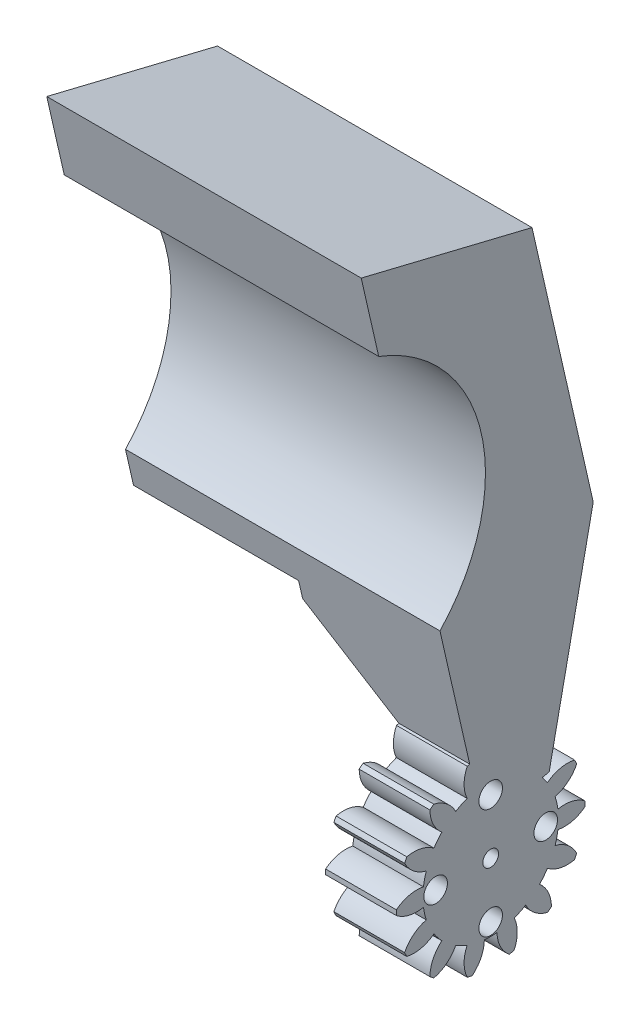
from build123d import *

# Parameters (mm, degrees)
BOSS_EXTRUDE1_START     = -9
BOSS_EXTRUDE1_OUTLINE_R = 1
BOSS_EXTRUDE1_DEPTH     = 9
BOSS_EXTRUDE1_START_2   = -10
BOSS_EXTRUDE1_2_DEPTH   = 1
BOSS_EXTRUDE2_START     = -40
BOSS_EXTRUDE2_DEPTH     = 40
CUT_EXTRUDE6_DEPTH      = 31
BOSS_EXTRUDE5_DEPTH     = 10
CHAMFER5_SIZE           = 10
SKETCH17_R              = 1.5000000000000002
SKETCH17_R_2            = 1.5000000000000004
SKETCH17_R_3            = 1.5
CUT_EXTRUDE7_DEPTH      = 81.58306320285853


with BuildPart() as part:
    # Boss-Extrude1: read off the stored shape, not the designer's step
    # Boss-Extrude1 outline → Boss-Extrude1 (new body)
    with BuildSketch(Plane(origin=(4.6139639648499715, 0, 0), x_dir=(0, 0, -1), z_dir=(1, 0, 0)).offset(BOSS_EXTRUDE1_START)):
        with BuildLine():
            ThreePointArc((-10.591117285, -4.446613705), (-10.456680456, -4.73552608), (-10.314619658, -5.020766944))
            ThreePointArc((-10.314619658, -5.020766944), (-8.502494616, -5.018593908), (-6.859954563, -4.253176333))
            ThreePointArc((-6.859954563, -4.253176333), (-6.387568746, -4.905897262), (-5.856328627, -5.51168345))
            ThreePointArc((-5.856328627, -5.51168345), (-6.968055133, -6.942720161), (-7.373409443, -8.708927899))
            ThreePointArc((-7.373409443, -8.708927899), (-7.126931664, -8.910899), (-6.875177934, -9.106254268))
            ThreePointArc((-6.875177934, -9.106254268), (-5.243452532, -8.318044841), (-4.095677319, -6.915756016))
            ThreePointArc((-4.095677319, -6.915756016), (-3.386867407, -7.298876727), (-2.645395822, -7.614174775))
            ThreePointArc((-2.645395822, -7.614174775), (-3.026123234, -9.385854353), (-2.625006031, -11.153029182))
            ThreePointArc((-2.625006031, -11.153029182), (-2.315305249, -11.228056157), (-2.003721502, -11.294833322))
            ThreePointArc((-2.003721502, -11.294833322), (-0.875578967, -9.876702048), (-0.449899552, -8.115282471))
            ThreePointArc((-0.449899552, -8.115282471), (0.354945958, -8.15292121), (1.159791469, -8.115282471))
            ThreePointArc((1.159791469, -8.115282471), (1.585470883, -9.876702048), (2.713613419, -11.294833322))
            ThreePointArc((2.713613419, -11.294833322), (3.025197166, -11.228056157), (3.334897948, -11.153029182))
            ThreePointArc((3.334897948, -11.153029182), (3.736015151, -9.385854353), (3.355287739, -7.614174775))
            ThreePointArc((3.355287739, -7.614174775), (4.096759324, -7.298876727), (4.805569236, -6.915756016))
            ThreePointArc((4.805569236, -6.915756016), (5.953344449, -8.318044841), (7.585069851, -9.106254268))
            ThreePointArc((7.585069851, -9.106254268), (7.836823581, -8.910899), (8.083301359, -8.708927899))
            ThreePointArc((8.083301359, -8.708927899), (7.677947049, -6.942720161), (6.566220544, -5.51168345))
            ThreePointArc((6.566220544, -5.51168345), (7.097460663, -4.905897262), (7.56984648, -4.253176333))
            ThreePointArc((7.56984648, -4.253176333), (9.212386533, -5.018593908), (11.024511575, -5.020766944))
            ThreePointArc((11.024511575, -5.020766944), (11.166572373, -4.73552608), (11.301009202, -4.446613705))
            ThreePointArc((11.301009202, -4.446613705), (10.169468771, -3.031192163), (8.546934241, -2.224232691))
            ThreePointArc((8.546934241, -2.224232691), (8.762724273, -1.447941745), (8.90512419, -0.654899984))
            ThreePointArc((8.90512419, -0.654899984), (10.717103882, -0.631845971), (12.350714974, 0.152447781))
            ThreePointArc((12.350714974, 0.152447781), (12.354945958, 0.47107879), (12.350714974, 0.789709799))
            ThreePointArc((12.350714974, 0.789709799), (10.717103881, 1.57400355), (8.90512419, 1.597057563))
            ThreePointArc((8.90512419, 1.597057563), (8.762724273, 2.390099324), (8.546934241, 3.16639027))
            ThreePointArc((8.546934241, 3.16639027), (10.169468771, 3.973349742), (11.301009202, 5.388771284))
            ThreePointArc((11.301009202, 5.388771284), (11.166572373, 5.677683659), (11.024511575, 5.962924523))
            ThreePointArc((11.024511575, 5.962924523), (9.212386533, 5.960751487), (7.56984648, 5.195333912))
            ThreePointArc((7.56984648, 5.195333912), (7.255600261, 5.643539152), (6.913552392, 6.070905362))
            Line((6.913552392, 6.070905362), (7.795891782, 6.27229357))
            Line((7.795891782, 6.27229357), (13.400397117, 33.194406922))
            Line((13.400397117, 33.194406922), (5.612164429, 67.316883848))
            Line((5.612164429, 67.316883848), (-16.111603154, 72.615744291))
            Line((-16.111603154, 72.615744291), (-13.886393815, 62.866465169))
            ThreePointArc((-13.886393815, 62.866465169), (-0.835936603, 47.895101758), (-6.098161126, 28.743988243))
            Line((-6.098161126, 28.743988243), (-2.315305249, 12.170213736))
            ThreePointArc((-2.315305249, 12.170213736), (-2.470404693, 12.133728304), (-2.625006031, 12.095186762))
            ThreePointArc((-2.625006031, 12.095186762), (-3.026123234, 10.328011932), (-2.645395822, 8.556332354))
            ThreePointArc((-2.645395822, 8.556332354), (-3.386867407, 8.241034306), (-4.095677319, 7.857913595))
            ThreePointArc((-4.095677319, 7.857913595), (-5.243452532, 9.260202421), (-6.875177934, 10.048411847))
            ThreePointArc((-6.875177934, 10.048411847), (-7.126931664, 9.853056579), (-7.373409443, 9.651085478))
            ThreePointArc((-7.373409443, 9.651085478), (-6.968055133, 7.88487774), (-5.856328627, 6.45384103))
            ThreePointArc((-5.856328627, 6.45384103), (-6.387568746, 5.848054841), (-6.859954563, 5.195333912))
            ThreePointArc((-6.859954563, 5.195333912), (-8.502494616, 5.960751487), (-10.314619658, 5.962924523))
            ThreePointArc((-10.314619658, 5.962924523), (-10.456680456, 5.677683659), (-10.591117285, 5.388771284))
            ThreePointArc((-10.591117285, 5.388771284), (-9.459576854, 3.973349742), (-7.837042324, 3.16639027))
            ThreePointArc((-7.837042324, 3.16639027), (-8.052832356, 2.390099324), (-8.195232274, 1.597057563))
            ThreePointArc((-8.195232274, 1.597057563), (-10.007211965, 1.57400355), (-11.640823057, 0.789709799))
            ThreePointArc((-11.640823057, 0.789709799), (-11.645054042, 0.47107879), (-11.640823057, 0.152447781))
            ThreePointArc((-11.640823057, 0.152447781), (-10.007211965, -0.631845971), (-8.195232274, -0.654899984))
            ThreePointArc((-8.195232274, -0.654899984), (-8.052832356, -1.447941745), (-7.837042324, -2.224232691))
            ThreePointArc((-7.837042324, -2.224232691), (-9.459576854, -3.031192163), (-10.591117285, -4.446613705))
        make_face()
        with Locations((0.354945958, 0.47107879)):
            Circle(BOSS_EXTRUDE1_OUTLINE_R, mode=Mode.SUBTRACT)
    extrude(amount=BOSS_EXTRUDE1_DEPTH)

    # Boss-Extrude1 2 outline → Boss-Extrude1 2 (add)
    with BuildSketch(Plane(origin=(4.6139639648499715, 0, 0), x_dir=(0, 0, -1), z_dir=(1, 0, 0)).offset(BOSS_EXTRUDE1_START_2)):
        with BuildLine():
            Line((-6.098161126, 28.743988243), (-0.535137777, 4.370790438))
            Line((-0.535137777, 4.370790438), (7.795891782, 6.27229357))
            Line((7.795891782, 6.27229357), (13.400397117, 33.194406922))
            Line((13.400397117, 33.194406922), (5.612164429, 67.316883848))
            Line((5.612164429, 67.316883848), (-16.111603154, 72.615744291))
            Line((-16.111603154, 72.615744291), (-13.886393815, 62.866465169))
            ThreePointArc((-13.886393815, 62.866465169), (-0.835936603, 47.895101758), (-6.098161126, 28.743988243))
        make_face()
    extrude(amount=BOSS_EXTRUDE1_2_DEPTH)

    # Sketch2 → Boss-Extrude2 (add)
    with BuildSketch(Plane(origin=(4.6139639648499715, 0, 0), x_dir=(0, 0, -1), z_dir=(1, 0, 0)).offset(BOSS_EXTRUDE2_START)):
        with BuildLine():
            Line((-16.11160315441779, 72.61574429110016), (5.612164428781802, 67.31688384840837))
            Line((5.612164428781802, 67.31688384840837), (13.400397117252913, 33.19440692204444))
            Line((13.400397117252913, 33.19440692204444), (8.3052597658331, 8.719121931463299))
            Line((8.3052597658331, 8.719121931463299), (-1.647742447257206, 9.245429999281619))
            Line((-1.647742447257206, 9.245429999281619), (-6.098161126383539, 28.743988242918082))
            ThreePointArc((-6.098161126383539, 28.743988242918082), (-0.8359366030316124, 47.895101758418704), (-13.886393814854628, 62.866465169281916))
            Line((-13.886393814854628, 62.866465169281916), (-16.11160315441779, 72.61574429110016))
        make_face()
    extrude(amount=BOSS_EXTRUDE2_DEPTH)

    # Sketch13 → Cut-Extrude6 (cut)
    with BuildSketch(Plane.ZY.offset(35.386036035150035)):
        Polygon((-7.7958917817334035, 6.272293570213381), (-10.852828441543005, 20.95676442675387), (5.0777102899861175, 24.273101006715667), (0.5351377774756237, 4.370790438372502), align=None)
    extrude(amount=-CUT_EXTRUDE6_DEPTH, mode=Mode.SUBTRACT)

    # Sketch15 → Boss-Extrude5 (add)
    with BuildSketch(Plane.ZY.offset(4.3860360351500285)):
        Polygon((-10.852828441543005, 20.95676442675387), (5.077710289986116, 24.273101006715674), (2.315305249124831, 12.17021373582128), (-9.187430109019209, 12.956764426753871), align=None)
    extrude(amount=BOSS_EXTRUDE5_DEPTH)

    # Chamfer5
    chamfer5_edges = [part.edges().sort_by_distance(p)[0] for p in [
        (-14.386036035150028, 12.563489081287575, -3.436062429947189),
    ]]
    chamfer(chamfer5_edges, length=CHAMFER5_SIZE - 0.0001)  # a hair under: the kernel refuses the full size

    # Sketch17 → Cut-Extrude7 (cut, through all)
    with BuildSketch(Plane.ZY.offset(4.3860360351500285)):
        with Locations((-0.35494595834961384, 7.471078789645248)):
            Circle(SKETCH17_R)
        with Locations((6.645054041650483, 0.47107878964532196)):
            Circle(SKETCH17_R)
        with Locations((-0.354945958349467, -6.528921210354753)):
            Circle(SKETCH17_R_2)
        with Locations((-7.354945958349516, 0.4710787896452233)):
            Circle(SKETCH17_R_3)
    extrude(amount=-CUT_EXTRUDE7_DEPTH, mode=Mode.SUBTRACT)


solid = part.part
